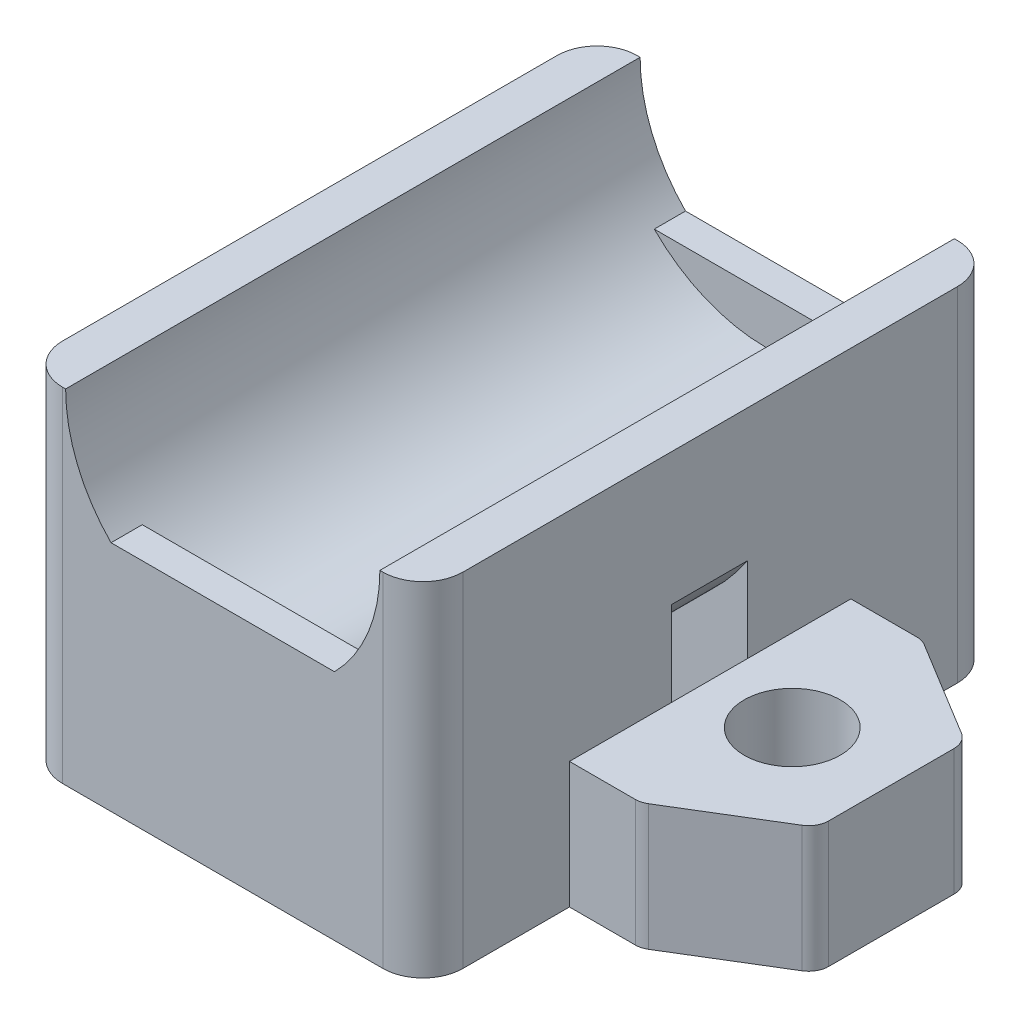
from build123d import *

# Parameters (mm, degrees)
SKETCH1_W            = 20
SKETCH1_H            = 28.7
BOSS_EXTRUDE1_DEPTH  = 17.15
CUT_EXTRUDE1_START   = -1.56
SKETCH2_R            = 7.85
CUT_EXTRUDE1_DEPTH   = 25.58
CUT_EXTRUDE2_DEPTH   = 39.959113
BOSS_EXTRUDE2_DEPTH  = 6.3
M4_CLEARANCE_HOLE1_D = 4.8
CUT_REVOLVE3_START   = -16.206498
CUT_REVOLVE3_DEPTH   = 3.8
CUT_REVOLVE4_START   = -16.206498
CUT_REVOLVE4_DEPTH   = 3.8
SKETCH10_W           = 20
SKETCH10_H           = 3.8
CUT_EXTRUDE3_DEPTH   = 5.3
FILLET1_R            = 2


# Read off the part's stored shape, not the designer's step: Cut-Revolve3, Cut-Revolve4
with BuildPart() as part:
    # Sketch1 → Boss-Extrude1 (new body)
    with BuildSketch(Plane(origin=(0, 0, 0), x_dir=(1, 0, 0), z_dir=(0, 1, 0))):
        with Locations((10, 14.35)):
            Rectangle(SKETCH1_W, SKETCH1_H)
    extrude(amount=BOSS_EXTRUDE1_DEPTH)

    # Sketch2 → Cut-Extrude1 (cut)
    with BuildSketch(Plane.XY.offset(CUT_EXTRUDE1_START)):
        with Locations((10, 17.15)):
            Circle(SKETCH2_R)
    extrude(amount=-CUT_EXTRUDE1_DEPTH, mode=Mode.SUBTRACT)

    # Sketch3 → Cut-Extrude2 (cut, through all)
    with BuildSketch(Plane.XY):
        with BuildLine():
            Line((2.15, 17.15), (17.85, 17.15))
            ThreePointArc((17.85, 17.15), (17.260735, 14.166005), (15.581407, 11.63))
            Line((15.581407, 11.63), (14.85, 11.63))
            Line((14.85, 11.63), (5.15, 11.63))
            Line((5.15, 11.63), (4.418593, 11.63))
            ThreePointArc((4.418593, 11.63), (2.739265, 14.166005), (2.15, 17.15))
        make_face()
    extrude(amount=-CUT_EXTRUDE2_DEPTH, mode=Mode.SUBTRACT)

    # Sketch4 → Boss-Extrude2 (add)
    with BuildSketch(Plane.XZ):
        with BuildLine():
            Line((20, -7.32), (23.289272, -7.32))
            ThreePointArc((23.289272, -7.32), (23.559552, -7.357218), (23.809713, -7.466102))
            Line((23.809713, -7.466102), (28.570441, -10.367714))
            ThreePointArc((28.570441, -10.367714), (28.921906, -10.731939), (29.05, -11.221612))
            Line((29.05, -11.221612), (29.05, -17.478388))
            ThreePointArc((29.05, -17.478388), (28.921906, -17.968061), (28.570441, -18.332286))
            Line((28.570441, -18.332286), (23.809713, -21.233898))
            ThreePointArc((23.809713, -21.233898), (23.559552, -21.342782), (23.289272, -21.38))
            Line((23.289272, -21.38), (20, -21.38))
            Line((20, -21.38), (20, -7.32))
        make_face()
    boss_extrude2 = extrude(amount=-BOSS_EXTRUDE2_DEPTH)

    # Mirror1: Boss-Extrude2 across plane
    add(boss_extrude2.mirror(Plane(origin=(10, 0, 0), x_dir=(0, 0, 1), z_dir=(1, 0, 0))))

    # M4 Clearance Hole1 (through all)
    with Locations(Plane(origin=(0, 6.3, 0), x_dir=(1, 0, 0), z_dir=(0, 1, 0))):
        with Locations((24.1, 14.35), (-4.1, 14.35)):
            Hole(M4_CLEARANCE_HOLE1_D / 2)

    # Cut-Revolve3 outline → Cut-Revolve3 (cut)
    with BuildSketch(Plane.XY.offset(CUT_REVOLVE3_START)):
        with BuildLine():
            Line((0, 10.534858), (0, 2.606187))
            ThreePointArc((0, 2.606187), (2.795508, 1.037341), (5.828669, 0))
            Line((5.828669, 0), (10, 0))
            Line((10, 0), (10, 5.16))
            ThreePointArc((10, 5.16), (4.323533, 6.588853), (0, 10.534858))
        make_face()
    extrude(amount=CUT_REVOLVE3_DEPTH, mode=Mode.SUBTRACT)

    # Cut-Revolve4 outline → Cut-Revolve4 (cut)
    with BuildSketch(Plane.XY.offset(CUT_REVOLVE4_START)):
        with BuildLine():
            ThreePointArc((20, 10.534858), (15.676467, 6.588853), (10, 5.16))
            Line((10, 5.16), (10, 0))
            Line((10, 0), (14.171331, 0))
            ThreePointArc((14.171331, 0), (17.204492, 1.037341), (20, 2.606187))
            Line((20, 2.606187), (20, 10.534858))
        make_face()
    extrude(amount=CUT_REVOLVE4_DEPTH, mode=Mode.SUBTRACT)

    # Sketch10 → Cut-Extrude3 (cut)
    with BuildSketch(Plane.XZ):
        with Locations((10.028669, -14.306498)):
            Rectangle(SKETCH10_W, SKETCH10_H)
    extrude(amount=-CUT_EXTRUDE3_DEPTH, mode=Mode.SUBTRACT)

    # Fillet1
    fillet1_edges = [part.edges().sort_by_distance(p)[0] for p in [
        (0, 8.575, -28.7),
        (20, 8.575, -28.7),
        (20, 8.575, 0),
        (0, 8.575, 0),
    ]]
    fillet(fillet1_edges, radius=FILLET1_R)


solid = part.part
